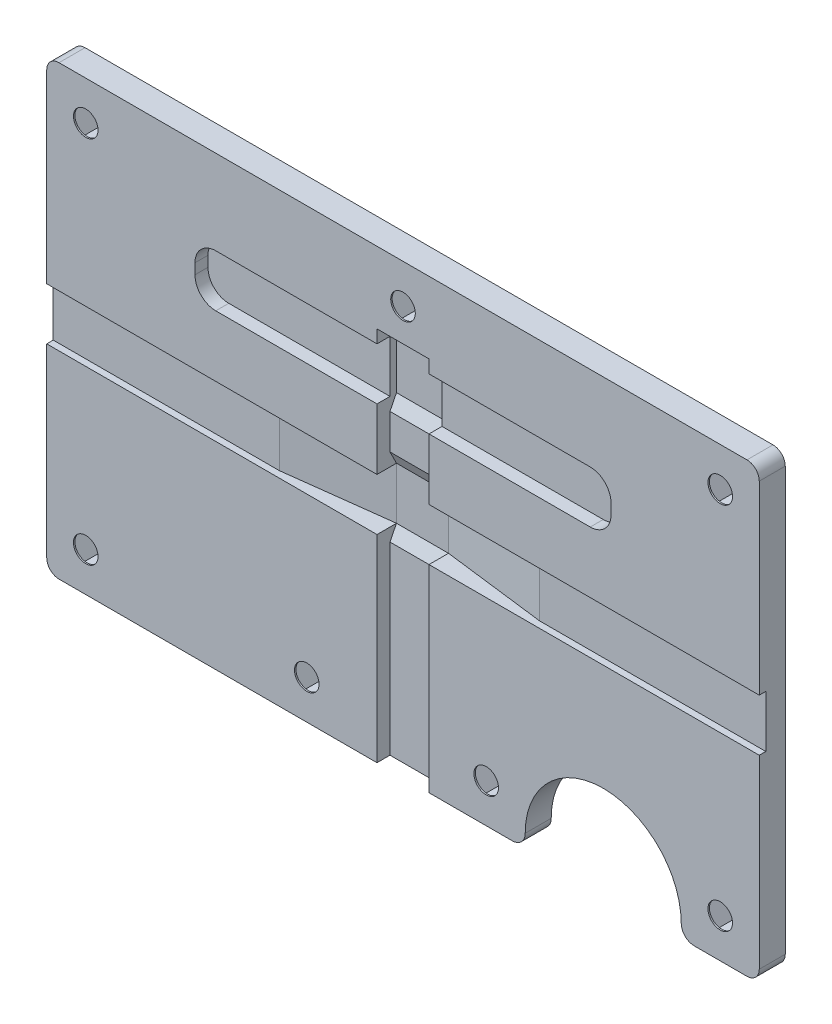
from build123d import *
from OCP.BRepFilletAPI import BRepFilletAPI_MakeChamfer

# Parameters (mm, degrees)
SKETCH1_R           = 1.5
BOSS_EXTRUDE1_DEPTH = 3.175
SKETCH2_W           = 86.995
SKETCH2_H           = 6.35
CUT_EXTRUDE1_DEPTH  = 0.79375
SKETCH3_W           = 6.35
SKETCH3_H           = 30.48
CUT_EXTRUDE2_DEPTH  = 1.5875
SKETCH4_W           = 6.35
SKETCH4_H           = 15.39875
CUT_EXTRUDE3_DEPTH  = 1.5875
SKETCH6_W           = 6.35
SKETCH6_H           = 6.35
CUT_EXTRUDE4_DEPTH  = 0.79375
CHAMFER2_SIZE       = 1.5875
CHAMFER2_SIZE_2     = 0.79375
CUT_EXTRUDE5_DEPTH  = 1.5875
CUT_EXTRUDE6_DEPTH  = 3
SKETCH11_W          = 6.35
SKETCH11_H          = 6.35
CUT_EXTRUDE8_DEPTH  = 0.79375
CHAMFER3_START      = 22.750484618
CHAMFER3_DEPTH      = 6.35
CHAMFER4_SIZE       = 0.79375
CHAMFER4_SIZE_2     = 1.5875


with BuildPart() as part:
    # Sketch1 → Boss-Extrude1 (new body)
    with BuildSketch(Plane.XY.offset(1.6)):
        with BuildLine():
            Line((-17.641226071, 51.730484618), (-17.641226071, 0.120484618))
            ThreePointArc((-17.641226071, 0.120484618), (-17.201886242, -0.940175553), (-16.141226071, -1.379515382))
            Line((-16.141226071, -1.379515382), (39.191273929, -1.379515382))
            ThreePointArc((39.191273929, -1.379515382), (40.313805944, -0.914547397), (40.778773929, 0.207984618))
            ThreePointArc((40.778773929, 0.207984618), (50.303773929, 9.732984618), (59.828773929, 0.207984618))
            ThreePointArc((59.828773929, 0.207984618), (60.293741914, -0.914547397), (61.416273929, -1.379515382))
            Line((61.416273929, -1.379515382), (67.853773929, -1.379515382))
            ThreePointArc((67.853773929, -1.379515382), (68.914434101, -0.940175553), (69.353773929, 0.120484618))
            Line((69.353773929, 0.120484618), (69.353773929, 51.730484618))
            ThreePointArc((69.353773929, 51.730484618), (68.914434101, 52.79114479), (67.853773929, 53.230484618))
            Line((67.853773929, 53.230484618), (-16.141226071, 53.230484618))
            ThreePointArc((-16.141226071, 53.230484618), (-17.201886242, 52.79114479), (-17.641226071, 51.730484618))
        make_face()
        with Locations(Location((-12.878726071, 48.467984618, 0), (0, 0, 180))):
            Circle(SKETCH1_R, mode=Mode.SUBTRACT)
        with Locations(Location((-12.878726071, 3.382984618, 0), (0, 0, 180))):
            Circle(SKETCH1_R, mode=Mode.SUBTRACT)
        with Locations(Location((64.591273929, 3.382984618, 0), (0, 0, 180))):
            Circle(SKETCH1_R, mode=Mode.SUBTRACT)
        with Locations(Location((64.591273929, 48.467984618, 0), (0, 0, 180))):
            Circle(SKETCH1_R, mode=Mode.SUBTRACT)
        with Locations(Location((14.108773929, 3.382984618, 0), (0, 0, 180))):
            Circle(SKETCH1_R, mode=Mode.SUBTRACT)
        with Locations(Location((36.016273929, 3.382984618, 0), (0, 0, 180))):
            Circle(SKETCH1_R, mode=Mode.SUBTRACT)
        with Locations(Location((25.856273929, 48.467984618, 0), (0, 0, 180))):
            Circle(SKETCH1_R, mode=Mode.SUBTRACT)
    extrude(amount=-BOSS_EXTRUDE1_DEPTH)

    # Sketch2 → Cut-Extrude1 (cut)
    with BuildSketch(Plane.XY.offset(1.6)):
        with Locations((25.856273929, 25.925484618)):
            Rectangle(SKETCH2_W, SKETCH2_H)
    extrude(amount=-CUT_EXTRUDE1_DEPTH, mode=Mode.SUBTRACT)

    # Sketch3 → Cut-Extrude2 (cut)
    with BuildSketch(Plane.XY.offset(1.6)):
        with Locations((25.856273929, 13.860484618)):
            Rectangle(SKETCH3_W, SKETCH3_H)
    extrude(amount=-CUT_EXTRUDE2_DEPTH, mode=Mode.SUBTRACT)

    # Sketch4 → Cut-Extrude3 (cut)
    with BuildSketch(Plane.XY.offset(1.6)):
        with Locations((25.856273929, 36.799859618)):
            Rectangle(SKETCH4_W, SKETCH4_H)
    extrude(amount=-CUT_EXTRUDE3_DEPTH, mode=Mode.SUBTRACT)

    # Sketch6 → Cut-Extrude4 (cut)
    with BuildSketch(Plane.XY.offset(0.0125)):
        with Locations((25.856273929, 39.736734618)):
            Rectangle(SKETCH6_W, SKETCH6_H)
    extrude(amount=-CUT_EXTRUDE4_DEPTH, mode=Mode.SUBTRACT)

    # Chamfer2
    chamfer2_edges_1 = [part.edges().sort_by_distance(p)[0] for p in [
        (25.856273929, 36.561734618, 0.0125),
    ]]
    chamfer2_side_1 = [part.faces().sort_by_distance(p)[0] for p in [
        (25.856273929, 36.545859618, 0.0125),
    ]]
    chamfer2_edges_2 = [part.edges().sort_by_distance(p)[0] for p in [
        (25.856273929, 42.911734618, 0.0125),
    ]]
    chamfer2_side_2 = [part.faces().sort_by_distance(p)[0] for p in [
        (25.856273929, 42.927609618, 0.0125),
    ]]
    chamfer2 = BRepFilletAPI_MakeChamfer(part.part.solid().wrapped)
    for e in chamfer2_edges_1:
        chamfer2.Add(CHAMFER2_SIZE - 0.0001, CHAMFER2_SIZE_2 - 0.0001, e.wrapped, chamfer2_side_1[0].wrapped)
    for e in chamfer2_edges_2:
        chamfer2.Add(CHAMFER2_SIZE - 0.0001, CHAMFER2_SIZE_2 - 0.0001, e.wrapped, chamfer2_side_2[0].wrapped)
    add(Compound.cast(chamfer2.Shape()), mode=Mode.REPLACE)  # a hair under: the kernel refuses the full size

    # Sketch7 → Cut-Extrude5 (cut)
    with BuildSketch(Plane.XY.offset(1.6)):
        with BuildLine():
            Line((48.716273929, 42.911734618), (2.996273929, 42.911734618))
            ThreePointArc((2.996273929, 42.911734618), (1.200222705, 42.167785843), (0.456273929, 40.371734618))
            Line((0.456273929, 40.371734618), (0.456273929, 39.101734618))
            ThreePointArc((0.456273929, 39.101734618), (1.200222705, 37.305683394), (2.996273929, 36.561734618))
            Line((2.996273929, 36.561734618), (48.716273929, 36.561734618))
            ThreePointArc((48.716273929, 36.561734618), (50.512325153, 37.305683394), (51.256273929, 39.101734618))
            Line((51.256273929, 39.101734618), (51.256273929, 40.371734618))
            ThreePointArc((51.256273929, 40.371734618), (50.512325153, 42.167785843), (48.716273929, 42.911734618))
        make_face()
    extrude(amount=-CUT_EXTRUDE5_DEPTH, mode=Mode.SUBTRACT)

    # Sketch9 → Cut-Extrude6 (cut)
    with BuildSketch(Plane(origin=(0, 0, -1.575), x_dir=(-1, 0, 0), z_dir=(0, 0, -1))):
        Polygon((-22.623145199, 48.453426307), (-24.227101696, 51.260677077), (-27.460230427, 51.275235389), (-29.08940266, 48.48254293), (-27.485446162, 45.67529216), (-24.252317432, 45.660733848), align=None)
        Polygon((-10.875621178, 3.375460135), (-12.48568116, 6.179214794), (-15.718833912, 6.186739277), (-17.341926681, 3.390509102), (-15.731866699, 0.586754443), (-12.498713947, 0.57922996), align=None)
        Polygon((16.111859882, 3.369602212), (14.50688248, 6.17626943), (11.273748669, 6.189651836), (9.645592259, 3.396367025), (11.250569661, 0.589699807), (14.483703473, 0.576317401), align=None)
        Polygon((16.1118088, 48.445414775), (14.514813493, 51.256631473), (11.281730764, 51.279201317), (9.645643341, 48.490554462), (11.242638648, 45.679337764), (14.475721377, 45.65676792), align=None)
        Polygon((-61.358112429, 48.468201712), (-62.974881187, 51.268093159), (-66.208042688, 51.267876066), (-67.824435429, 48.467767525), (-66.207666671, 45.667876078), (-62.974505171, 45.668093171), align=None)
        Polygon((-61.358112422, 3.382984618), (-62.974693176, 6.182984618), (-66.207854683, 6.182984618), (-67.824435437, 3.382984618), (-66.207854683, 0.582984618), (-62.974693176, 0.582984618), align=None)
        Polygon((-32.784301689, 3.295298985), (-34.324349823, 6.138111866), (-37.556322063, 6.2257975), (-39.24824617, 3.470670252), (-37.708198036, 0.627857371), (-34.476225796, 0.540171737), align=None)
    extrude(amount=-CUT_EXTRUDE6_DEPTH, mode=Mode.SUBTRACT)

    # Sketch11 → Cut-Extrude8 (cut)
    with BuildSketch(Plane.XY.offset(0.0125)):
        with Locations((25.856273929, 25.925484618)):
            Rectangle(SKETCH11_W, SKETCH11_H)
    extrude(amount=-CUT_EXTRUDE8_DEPTH, mode=Mode.SUBTRACT)

    # Chamfer3: read off the stored shape, not the designer's step
    # Chamfer3 outline → Chamfer3 (cut)
    with BuildSketch(Plane(origin=(0, 0, 0), x_dir=(1, 0, 0), z_dir=(0, 1, 0)).offset(CHAMFER3_START)):
        Polygon((22.681273929, 0.78125), (9.981273929, -0.80625), (22.681273929, -0.80625), align=None)
        Polygon((41.731273929, -0.80625), (29.031273929, 0.78125), (29.031273929, -0.80625), align=None)
    extrude(amount=CHAMFER3_DEPTH, mode=Mode.SUBTRACT)

    # Chamfer4
    chamfer4_edges_1 = [part.edges().sort_by_distance(p)[0] for p in [
        (25.856273929, 22.750484618, 0.0125),
    ]]
    chamfer4_side_1 = [part.faces().sort_by_distance(p)[0] for p in [
        (25.856273929, 22.750484618, -0.003375),
    ]]
    chamfer4_edges_2 = [part.edges().sort_by_distance(p)[0] for p in [
        (25.856273929, 29.100484618, 0.0125),
    ]]
    chamfer4_side_2 = [part.faces().sort_by_distance(p)[0] for p in [
        (25.856273929, 29.100484618, -0.003375),
    ]]
    chamfer4 = BRepFilletAPI_MakeChamfer(part.part.solid().wrapped)
    for e in chamfer4_edges_1:
        chamfer4.Add(CHAMFER4_SIZE - 0.0001, CHAMFER4_SIZE_2 - 0.0001, e.wrapped, chamfer4_side_1[0].wrapped)
    for e in chamfer4_edges_2:
        chamfer4.Add(CHAMFER4_SIZE - 0.0001, CHAMFER4_SIZE_2 - 0.0001, e.wrapped, chamfer4_side_2[0].wrapped)
    add(Compound.cast(chamfer4.Shape()), mode=Mode.REPLACE)  # a hair under: the kernel refuses the full size


solid = part.part
